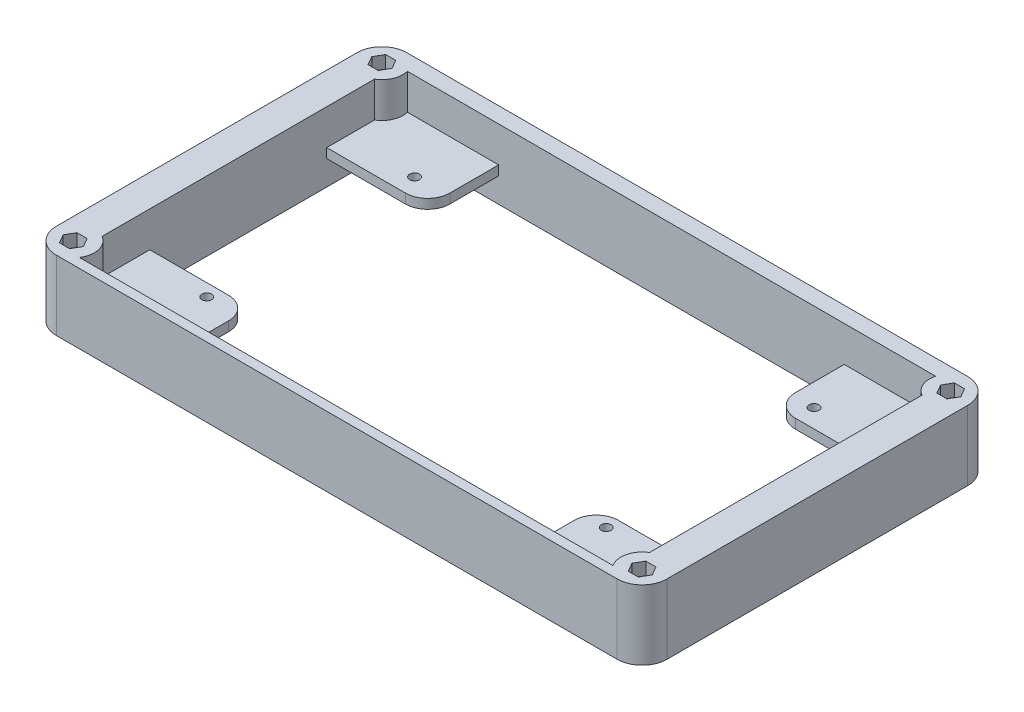
from build123d import *

# Parameters (mm, degrees)
CROQUIS1_W              = 192.96
CROQUIS1_H              = 110.76
CROQUIS1_W_2            = 172.96
CROQUIS1_H_2            = 102.76
SALIENTE_EXTRUIR2_DEPTH = 18
CROQUIS2_W              = 31.89
CROQUIS2_H              = 3
SALIENTE_EXTRUIR3_DEPTH = 24.43
CROQUIS3_W              = 31.89
CROQUIS3_H              = 3
SALIENTE_EXTRUIR4_DEPTH = 22.43
CROQUIS1_2_W            = 192.96
CROQUIS1_2_H            = 110.76
CROQUIS1_2_W_2          = 172.96
CROQUIS1_2_H_2          = 102.76
SALIENTE_EXTRUIR5_DEPTH = 22
CROQUIS6_R              = 6.63
SALIENTE_EXTRUIR6_DEPTH = 22
CROQUIS7_R              = 1.55
CORTAR_EXTRUIR1_DEPTH   = 22
CORTAR_EXTRUIR2_DEPTH   = 4
REDONDEO1_R             = 7.88
REDONDEO2_R             = 7.88
REDONDEO3_R             = 7.88
REDONDEO4_R             = 7.88
CROQUIS9_R              = 1.55
CORTAR_EXTRUIR3_DEPTH   = 4
CROQUIS10_W             = 172.96
CROQUIS10_H             = 102.76
CORTAR_EXTRUIR5_DEPTH   = 7.8
REDONDEO5_R             = 7
REDONDEO6_R             = 7
REDONDEO7_R             = 7
REDONDEO8_R             = 7
CROQUIS11_W             = 80
CROQUIS11_H             = 1.5
CORTAR_EXTRUIR6_DEPTH   = 7.8
REDONDEO9_R             = 1.5


with BuildPart() as part:
    # Croquis1 → Saliente-Extruir2 (new body)
    with BuildSketch(Plane(origin=(0, 0, 0), x_dir=(1, 0, 0), z_dir=(0, 1, 0))):
        with Locations((96.48, 55.38)):
            Rectangle(CROQUIS1_W, CROQUIS1_H)
        with Locations((96.48, 54.38)):
            Rectangle(CROQUIS1_W_2, CROQUIS1_H_2, mode=Mode.SUBTRACT)
    extrude(amount=SALIENTE_EXTRUIR2_DEPTH)

    # Croquis2 → Saliente-Extruir3 (add)
    with BuildSketch(Plane(origin=(0, 0, -3), x_dir=(-1, 0, 0), z_dir=(0, 0, -1))):
        with Locations((-25.945, 9.3)):
            Rectangle(CROQUIS2_W, CROQUIS2_H)
        with Locations((-167.015, 9.3)):
            Rectangle(CROQUIS2_W, CROQUIS2_H)
    extrude(amount=SALIENTE_EXTRUIR3_DEPTH)

    # Croquis3 → Saliente-Extruir4 (add)
    with BuildSketch(Plane.XY.offset(-105.76)):
        with Locations((167.015, 9.3)):
            Rectangle(CROQUIS3_W, CROQUIS3_H)
        with Locations((25.945, 9.3)):
            Rectangle(CROQUIS3_W, CROQUIS3_H)
    extrude(amount=SALIENTE_EXTRUIR4_DEPTH)

    # Croquis1<2> → Saliente-Extruir5 (add)
    with BuildSketch(Plane(origin=(0, 0, 0), x_dir=(1, 0, 0), z_dir=(0, 1, 0))):
        with Locations((96.48, 55.38)):
            Rectangle(CROQUIS1_2_W, CROQUIS1_2_H)
        with Locations((96.48, 54.38)):
            Rectangle(CROQUIS1_2_W_2, CROQUIS1_2_H_2, mode=Mode.SUBTRACT)
    extrude(amount=SALIENTE_EXTRUIR5_DEPTH)

    # Croquis6 → Saliente-Extruir6 (add)
    with BuildSketch(Plane(origin=(0, 22, 0), x_dir=(1, 0, 0), z_dir=(0, 1, 0))):
        with Locations((6.63, 6.63)):
            Circle(CROQUIS6_R)
        with Locations((6.63, 104.13)):
            Circle(CROQUIS6_R)
        with Locations((186.33, 104.13)):
            Circle(CROQUIS6_R)
        with Locations((186.33, 6.63)):
            Circle(CROQUIS6_R)
    extrude(amount=-SALIENTE_EXTRUIR6_DEPTH)

    # Croquis7 → Cortar-Extruir1 (cut)
    with BuildSketch(Plane(origin=(0, 22, 0), x_dir=(1, 0, 0), z_dir=(0, 1, 0))):
        with Locations(Location((6.63, 104.13, 0), (0, 0, 270))):
            Circle(CROQUIS7_R)
        with Locations(Location((186.33, 104.13, 0), (0, 0, 270))):
            Circle(CROQUIS7_R)
        with Locations(Location((186.33, 6.63, 0), (0, 0, 270))):
            Circle(CROQUIS7_R)
        with Locations(Location((6.63, 6.63, 0), (0, 0, 270))):
            Circle(CROQUIS7_R)
    extrude(amount=-CORTAR_EXTRUIR1_DEPTH, mode=Mode.SUBTRACT)

    # Croquis8 → Cortar-Extruir2 (cut)
    with BuildSketch(Plane(origin=(0, 22, 0), x_dir=(1, 0, 0), z_dir=(0, 1, 0))):
        Polygon((189.534293994, 6.63), (187.932146997, 9.405), (184.727853003, 9.405), (183.125706006, 6.63), (184.727853003, 3.855), (187.932146997, 3.855), align=None)
        Polygon((189.534293994, 104.13), (187.932146997, 106.905), (184.727853003, 106.905), (183.125706006, 104.13), (184.727853003, 101.355), (187.932146997, 101.355), align=None)
        Polygon((9.834293994, 6.63), (8.232146997, 9.405), (5.027853003, 9.405), (3.425706006, 6.63), (5.027853003, 3.855), (8.232146997, 3.855), align=None)
        Polygon((9.834293994, 104.13), (8.232146997, 106.905), (5.027853003, 106.905), (3.425706006, 104.13), (5.027853003, 101.355), (8.232146997, 101.355), align=None)
    extrude(amount=-CORTAR_EXTRUIR2_DEPTH, mode=Mode.SUBTRACT)

    # Redondeo1
    redondeo1_edges = [part.edges().sort_by_distance(p)[0] for p in [
        (0, 11, 0),
    ]]
    fillet(redondeo1_edges, radius=REDONDEO1_R)

    # Redondeo2
    redondeo2_edges = [part.edges().sort_by_distance(p)[0] for p in [
        (0, 11, -110.76),
    ]]
    fillet(redondeo2_edges, radius=REDONDEO2_R)

    # Redondeo3
    redondeo3_edges = [part.edges().sort_by_distance(p)[0] for p in [
        (192.96, 11, -110.76),
    ]]
    fillet(redondeo3_edges, radius=REDONDEO3_R)

    # Redondeo4
    redondeo4_edges = [part.edges().sort_by_distance(p)[0] for p in [
        (192.96, 11, 0),
    ]]
    fillet(redondeo4_edges, radius=REDONDEO4_R)

    # Croquis9 → Cortar-Extruir3 (cut)
    with BuildSketch(Plane.XZ.offset(-7.8)):
        with Locations((158.09, -89.18)):
            Circle(CROQUIS9_R)
        with Locations((158.09, -23.53)):
            Circle(CROQUIS9_R)
        with Locations((31.89, -89.18)):
            Circle(CROQUIS9_R)
        with Locations((31.89, -23.53)):
            Circle(CROQUIS9_R)
    extrude(amount=-CORTAR_EXTRUIR3_DEPTH, mode=Mode.SUBTRACT)

    # Croquis10 → Cortar-Extruir5 (cut)
    with BuildSketch(Plane.XZ):
        with Locations((96.48, -54.38)):
            Rectangle(CROQUIS10_W, CROQUIS10_H)
    extrude(amount=-CORTAR_EXTRUIR5_DEPTH, mode=Mode.SUBTRACT)

    # Redondeo5
    redondeo5_edges = [part.edges().sort_by_distance(p)[0] for p in [
        (151.07, 9.3, -27.43),
    ]]
    fillet(redondeo5_edges, radius=REDONDEO5_R)

    # Redondeo6
    redondeo6_edges = [part.edges().sort_by_distance(p)[0] for p in [
        (151.07, 9.3, -83.33),
    ]]
    fillet(redondeo6_edges, radius=REDONDEO6_R)

    # Redondeo7
    redondeo7_edges = [part.edges().sort_by_distance(p)[0] for p in [
        (41.89, 9.3, -83.33),
    ]]
    fillet(redondeo7_edges, radius=REDONDEO7_R)

    # Redondeo8
    redondeo8_edges = [part.edges().sort_by_distance(p)[0] for p in [
        (41.89, 9.3, -27.43),
    ]]
    fillet(redondeo8_edges, radius=REDONDEO8_R)

    # Croquis11 → Cortar-Extruir6 (cut)
    with BuildSketch(Plane(origin=(0, 0, 0), x_dir=(-1, 0, 0), z_dir=(0, -1, 0))):
        with Locations((-96.48, 2.25)):
            Rectangle(CROQUIS11_W, CROQUIS11_H)
    extrude(amount=-CORTAR_EXTRUIR6_DEPTH, mode=Mode.SUBTRACT)

    # Redondeo9
    redondeo9_edges = [part.edges().sort_by_distance(p)[0] for p in [
        (96.48, 7.8, -1.5),
    ]]
    fillet(redondeo9_edges, radius=REDONDEO9_R - 0.0001)  # a hair under: the kernel refuses the full size


solid = part.part
